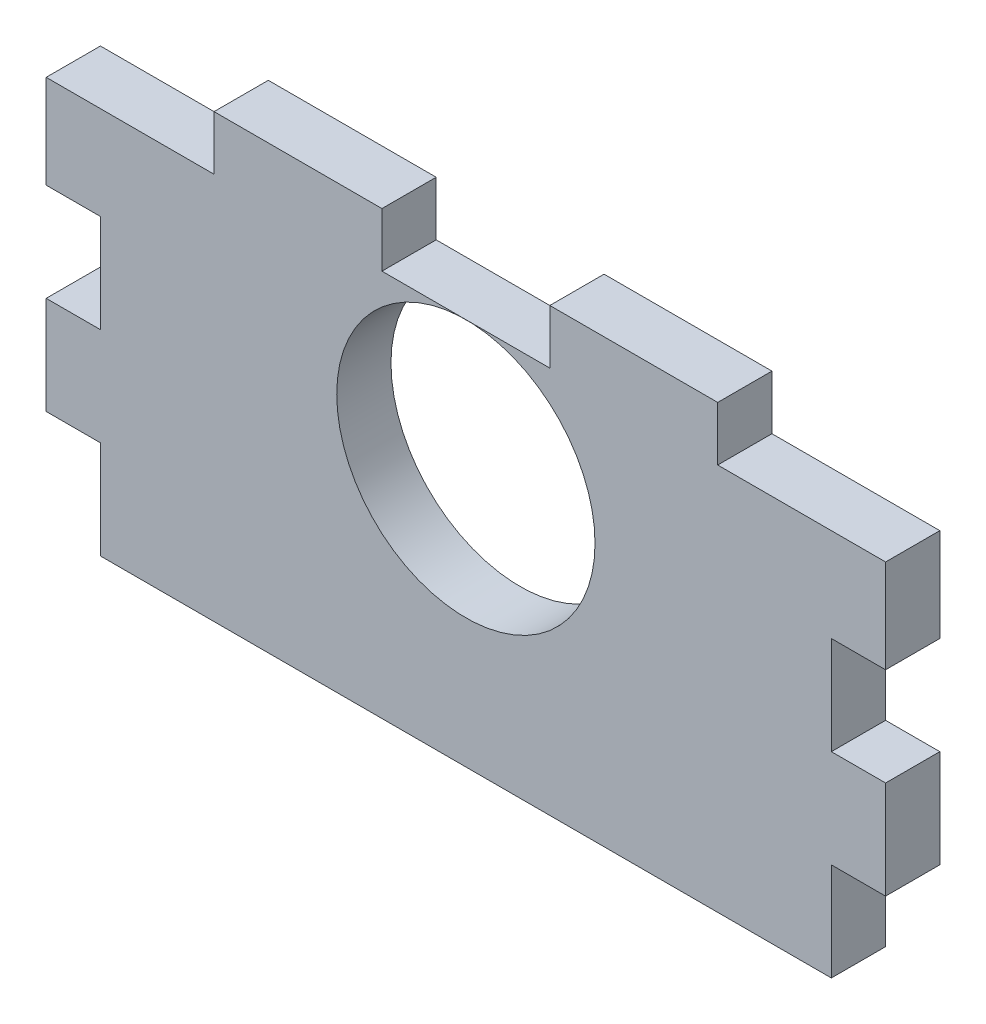
from build123d import *

# Parameters (mm, degrees)
SKETCH1_W                = 82.55
SKETCH1_H                = 43.434
BOSS_EXTRUDE1_DEPTH      = 5.334
CUT_EXTRUDE1_START       = -88.085249325
CUT_EXTRUDE1_OUTLINE_W   = 5.334
CUT_EXTRUDE1_OUTLINE_H   = 5.334
CUT_EXTRUDE1_DEPTH       = 16.51
CUT_EXTRUDE1_START_2     = -55.065249325
CUT_EXTRUDE1_2_OUTLINE_W = 5.334
CUT_EXTRUDE1_2_OUTLINE_H = 5.334
CUT_EXTRUDE1_2_DEPTH     = 16.51
CUT_EXTRUDE1_START_3     = -22.045249325
CUT_EXTRUDE1_3_OUTLINE_W = 5.334
CUT_EXTRUDE1_3_OUTLINE_H = 5.334
CUT_EXTRUDE1_3_DEPTH     = 16.51
SKETCH3_W                = 5.334
SKETCH3_H                = 9.638319844
SKETCH3_H_2              = 9.638319843
CUT_EXTRUDE2_DEPTH       = 93.990910348
SKETCH4_R                = 12.7
CUT_EXTRUDE3_DEPTH       = 93.990910348


# Read off the part's stored shape, not the designer's step: Cut-Extrude1
with BuildPart() as part:
    # Sketch1 → Boss-Extrude1 (new body)
    with BuildSketch(Plane.XY):
        with Locations((-46.810249325, -7.606142782)):
            Rectangle(SKETCH1_W, SKETCH1_H)
    extrude(amount=BOSS_EXTRUDE1_DEPTH)

    # Cut-Extrude1 outline → Cut-Extrude1 (cut)
    with BuildSketch(Plane.YZ.offset(CUT_EXTRUDE1_START)):
        with Locations((11.443857218, 2.667)):
            Rectangle(CUT_EXTRUDE1_OUTLINE_W, CUT_EXTRUDE1_OUTLINE_H)
    extrude(amount=CUT_EXTRUDE1_DEPTH, mode=Mode.SUBTRACT)

    # Cut-Extrude1 2 outline → Cut-Extrude1 2 (cut)
    with BuildSketch(Plane.YZ.offset(CUT_EXTRUDE1_START_2)):
        with Locations((11.443857218, 2.667)):
            Rectangle(CUT_EXTRUDE1_2_OUTLINE_W, CUT_EXTRUDE1_2_OUTLINE_H)
    extrude(amount=CUT_EXTRUDE1_2_DEPTH, mode=Mode.SUBTRACT)

    # Cut-Extrude1 3 outline → Cut-Extrude1 3 (cut)
    with BuildSketch(Plane.YZ.offset(CUT_EXTRUDE1_START_3)):
        with Locations((11.443857218, 2.667)):
            Rectangle(CUT_EXTRUDE1_3_OUTLINE_W, CUT_EXTRUDE1_3_OUTLINE_H)
    extrude(amount=CUT_EXTRUDE1_3_DEPTH, mode=Mode.SUBTRACT)

    # Sketch3 → Cut-Extrude2 (cut, through all)
    with BuildSketch(Plane.XY.offset(5.334)):
        with Locations((-85.418249325, -24.50398286)):
            Rectangle(SKETCH3_W, SKETCH3_H)
        with Locations((-85.418249325, -5.227343173)):
            Rectangle(SKETCH3_W, SKETCH3_H_2)
        with Locations((-8.202249325, -24.50398286)):
            Rectangle(SKETCH3_W, SKETCH3_H)
        with Locations((-8.202249325, -5.227343173)):
            Rectangle(SKETCH3_W, SKETCH3_H_2)
    extrude(amount=-CUT_EXTRUDE2_DEPTH, mode=Mode.SUBTRACT)

    # Sketch4 → Cut-Extrude3 (cut, through all)
    with BuildSketch(Plane.XY.offset(5.334)):
        with Locations((-46.810249325, -3.923396782)):
            Circle(SKETCH4_R)
    extrude(amount=-CUT_EXTRUDE3_DEPTH, mode=Mode.SUBTRACT)


solid = part.part
